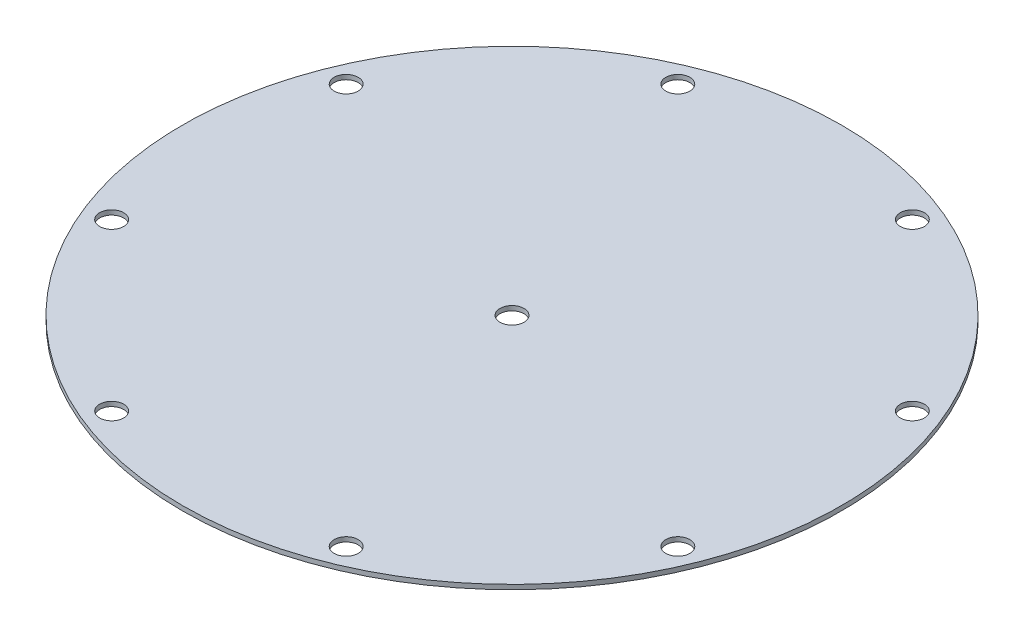
from build123d import *

# Parameters (mm, degrees)
SKETCH2_W                  = 71.2
SKETCH2_H                  = 1
F_6_0_204_DIAMETER_HOLE1_D = 5.1816
CIRPATTERN3_COUNT          = 8
F_6_0_204_DIAMETER_HOLE2_D = 5.1816


with BuildPart() as part:
    # Sketch2 → Revolve1 (revolve)
    with BuildSketch(Plane(origin=(0, 0, 0), x_dir=(0, 0, -1), z_dir=(1, 0, 0))):
        with Locations((-35.6, 0.5)):
            Rectangle(SKETCH2_W, SKETCH2_H)
    revolve(axis=Axis((0, -0.05, 0), (0, 1, 0)))

    # #6 (0.204) Diameter Hole1 (through all)
    with Locations(Plane(origin=(0, 1, 0), x_dir=(1, 0, 0), z_dir=(0, 1, 0))):
        with Locations((-25.333643223, 61.160825052)):
            f_6_0_204_diameter_hole1 = Hole(F_6_0_204_DIAMETER_HOLE1_D / 2)

    # CirPattern3: #6 (0.204) Diameter Hole1 ×8 about axis
    cirpattern3_axis = Axis((0, -0.05, 0), (0, 1, 0))
    for i in range(1, CIRPATTERN3_COUNT):
        add(f_6_0_204_diameter_hole1.rotate(cirpattern3_axis, i * 360 / CIRPATTERN3_COUNT), mode=Mode.SUBTRACT)

    # #6 (0.204) Diameter Hole2 (through all)
    with Locations(Plane(origin=(0, 1, 0), x_dir=(1, 0, 0), z_dir=(0, 1, 0))):
        with Locations((0, 0)):
            Hole(F_6_0_204_DIAMETER_HOLE2_D / 2)


solid = part.part
